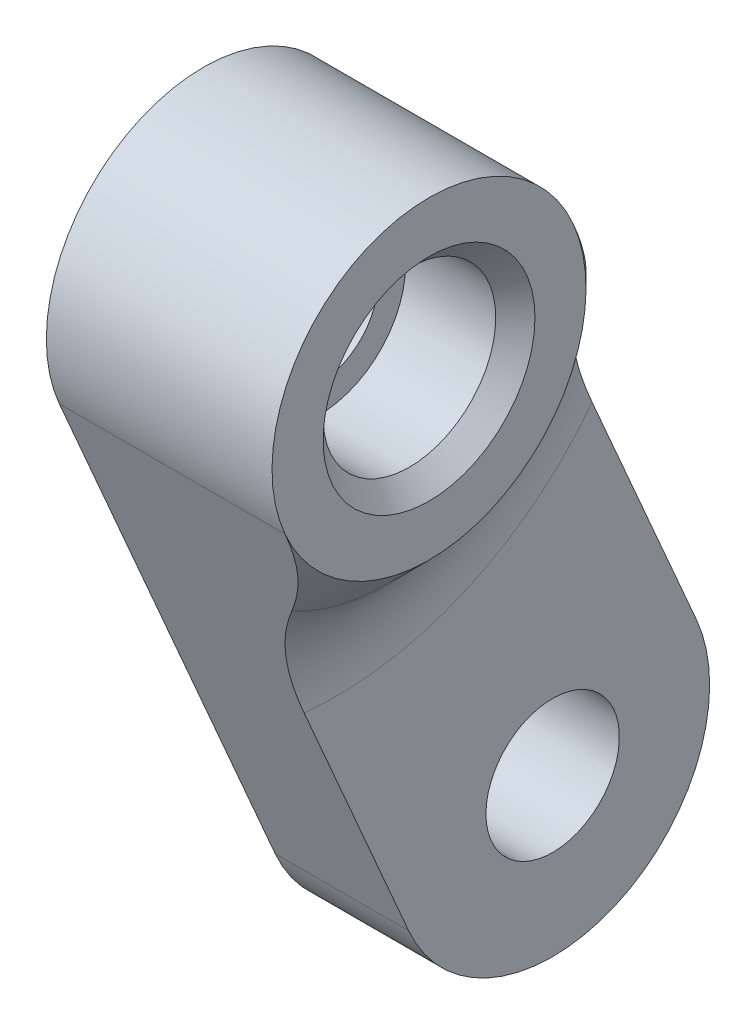
from build123d import *

# Parameters (mm, degrees)
BOSS_EXTRUDE1_DEPTH = 5.75
CUT_EXTRUDE1_DEPTH  = 2.35
HOLE1_D             = 3.4
HOLE2_D             = 3
HOLE2_CBORE_D       = 4.4
HOLE2_CBORE_DEPTH   = 2.8
CHAMFER1_SIZE       = 0.5
FILLET1_R           = 4.4


# Read off the part's stored shape, not the designer's step: Draft1
with BuildPart() as part:
    # Sketch1 → Boss-Extrude1 (new body)
    with BuildSketch(Plane(origin=(-31.596370889, 0, 0), x_dir=(0, 0, -1), z_dir=(1, 0, 0))):
        with BuildLine():
            Line((30.830485373, -54.332845156), (36.330485373, -67.009692228))
            ThreePointArc((36.330485373, -67.009692228), (41.592062311, -69.087144543), (43.669514627, -63.825567605))
            Line((43.669514627, -63.825567605), (38.169514627, -51.148720534))
            ThreePointArc((38.169514627, -51.148720534), (32.907937689, -49.071268218), (30.830485373, -54.332845156))
        make_face()
    extrude(amount=-BOSS_EXTRUDE1_DEPTH)

    # Sketch2 → Cut-Extrude1 (cut)
    with BuildSketch(Plane(origin=(-31.596370889, 0, 0), x_dir=(0, 0, -1), z_dir=(1, 0, 0))):
        with BuildLine():
            Line((32.793412497, -58.857159149), (36.330485373, -67.009692228))
            ThreePointArc((36.330485373, -67.009692228), (41.592062311, -69.087144543), (43.669514627, -63.825567605))
            Line((43.669514627, -63.825567605), (40.132441751, -55.673034527))
            ThreePointArc((40.132441751, -55.673034527), (37.027398919, -58.566137315), (32.793412497, -58.857159149))
        make_face()
    extrude(amount=-CUT_EXTRUDE1_DEPTH, mode=Mode.SUBTRACT)

    # Draft1 outline → Draft1 (revolve, cut)
    with BuildSketch(Plane(origin=(0, -52.740782845, -34.5), x_dir=(0, 1, 0), z_dir=(0, 0, -1))):
        Polygon((6.35, -31.596367589), (3.9999967, -31.596367589), (6.35, -33.946370889), align=None)
    revolve(axis=Axis((0, -52.740782845, -34.5), (1, 0, 0)), mode=Mode.SUBTRACT)

    # Hole1 (through all)
    with Locations(Plane.ZY.offset(37.346370889)):
        with Locations((-40, -65.417629916)):
            Hole(HOLE1_D / 2)

    # Hole2 (through all)
    with Locations(Plane(origin=(-31.596370889, 0, 0), x_dir=(0, 0, -1), z_dir=(1, 0, 0))):
        with Locations((34.5, -52.740782845)):
            CounterBoreHole(HOLE2_D / 2, HOLE2_CBORE_D / 2, HOLE2_CBORE_DEPTH)

    # Chamfer1
    chamfer1_edges = [part.edges().sort_by_distance(p)[0] for p in [
        (-31.596370889, -52.740782845, -32.3),
    ]]
    chamfer(chamfer1_edges, length=CHAMFER1_SIZE)

    # Fillet1
    fillet1_edges = [part.edges().sort_by_distance(p)[0] for p in [
        (-33.946370889, -58.566137315, -37.027398919),
    ]]
    fillet(fillet1_edges, radius=FILLET1_R)


solid = part.part
